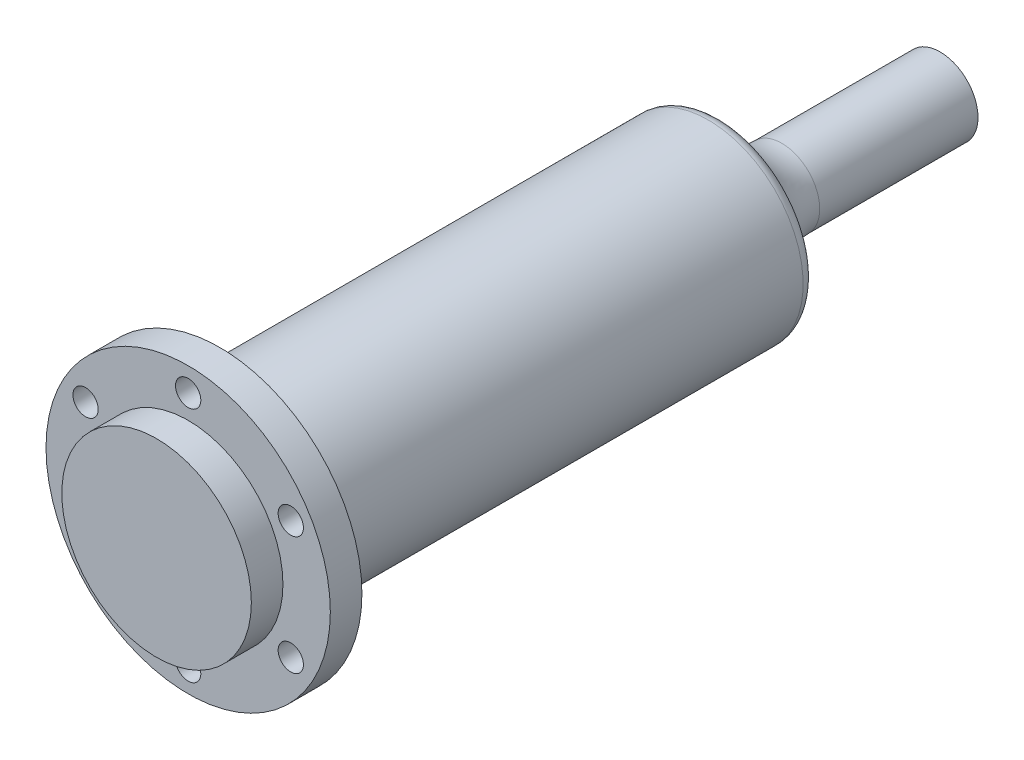
from build123d import *

# Parameters (mm, degrees)
SKETCH1_R           = 15
BOSS_EXTRUDE1_DEPTH = 72
SKETCH3_R           = 15
SKETCH3_R_2         = 7.5
BOSS_EXTRUDE2_DEPTH = 17
BOSS_EXTRUDE3_START = -5
SKETCH4_R           = 22.5
SKETCH4_R_2         = 12.5
SKETCH4_R_3         = 2
BOSS_EXTRUDE3_DEPTH = 5
SKETCH6_R           = 6
SKETCH6_R_2         = 3
BOSS_EXTRUDE4_DEPTH = 35
CUT_EXTRUDE2_START  = -67
SKETCH9_R           = 7.5
CUT_EXTRUDE2_DEPTH  = 67
CUT_EXTRUDE3_START  = -5
SKETCH10_R          = 3
CUT_EXTRUDE3_DEPTH  = 5
FILLET1_R           = 10
FILLET2_R           = 2
BOSS_EXTRUDE5_START = -84
SKETCH12_R          = 7.5
BOSS_EXTRUDE5_DEPTH = 84


with BuildPart() as part:
    # Sketch1 → Boss-Extrude1 (new body)
    with BuildSketch(Plane.XY):
        Circle(SKETCH1_R)
    extrude(amount=BOSS_EXTRUDE1_DEPTH)

    # Sketch3 → Boss-Extrude2 (add)
    with BuildSketch(Plane.XY.offset(72)):
        Circle(SKETCH3_R)
        Circle(SKETCH3_R_2, mode=Mode.SUBTRACT)
    extrude(amount=BOSS_EXTRUDE2_DEPTH)

    # Sketch4 → Boss-Extrude3 (add)
    with BuildSketch(Plane.XY.offset(89).offset(BOSS_EXTRUDE3_START)):
        Circle(SKETCH4_R)
        Circle(SKETCH4_R_2, mode=Mode.SUBTRACT)
        with Locations((0, 18.75)):
            Circle(SKETCH4_R_3, mode=Mode.SUBTRACT)
        with Locations((16.237976321, 9.375)):
            Circle(SKETCH4_R_3, mode=Mode.SUBTRACT)
        with Locations((16.237976321, -9.375)):
            Circle(SKETCH4_R_3, mode=Mode.SUBTRACT)
        with Locations((0, -18.75)):
            Circle(SKETCH4_R_3, mode=Mode.SUBTRACT)
        with Locations((-16.237976321, -9.375)):
            Circle(SKETCH4_R_3, mode=Mode.SUBTRACT)
        with Locations((-16.237976321, 9.375)):
            Circle(SKETCH4_R_3, mode=Mode.SUBTRACT)
    extrude(amount=-BOSS_EXTRUDE3_DEPTH)

    # Sketch6 → Boss-Extrude4 (add)
    with BuildSketch(Plane(origin=(0, 0, 0), x_dir=(-1, 0, 0), z_dir=(0, 0, -1))):
        with Locations(Location((0, 0, 0), (0, 0, 180))):
            Circle(SKETCH6_R)
        Circle(SKETCH6_R_2, mode=Mode.SUBTRACT)
    extrude(amount=BOSS_EXTRUDE4_DEPTH)

    # Sketch9 → Cut-Extrude2 (cut)
    with BuildSketch(Plane.XY.offset(72).offset(CUT_EXTRUDE2_START)):
        Circle(SKETCH9_R)
    extrude(amount=CUT_EXTRUDE2_DEPTH, mode=Mode.SUBTRACT)

    # Sketch10 → Cut-Extrude3 (cut)
    with BuildSketch(Plane(origin=(0, 0, 0), x_dir=(-1, 0, 0), z_dir=(0, 0, -1)).offset(CUT_EXTRUDE3_START)):
        with Locations(Location((0, 0, 0), (0, 0, 180))):
            Circle(SKETCH10_R)
    extrude(amount=CUT_EXTRUDE3_DEPTH, mode=Mode.SUBTRACT)

    # Fillet1
    # the kernel refuses this fillet: 10 mm, written as the material it adds along each edge
    with BuildSketch(Plane(origin=(0, 0, 0), x_dir=(1, 0, 0), z_dir=(0, 1, 0))) as fillet1_piece_1:
        with BuildLine():
            CenterArc((16, 9.949874371), FILLET1_R, 180, 84.260829523)
            Line((6, 9.949874371), (5.8, 9.949874371))
            Line((5.8, 9.949874371), (5.8, 0))
            Line((5.8, 0), (6, -0.2))
            ThreePointArc((6, -0.2), (10.5, -0.2), (14.98, -0.198997487))
            Line((14.98, -0.198997487), (15, 0))
        make_face()
    revolve(axis=Axis((0, 0, 0), (0, 0, -1)))

    # Fillet2
    fillet2_edges = [part.edges().sort_by_distance(p)[0] for p in [
        (-15, 0, 0),
    ]]
    fillet(fillet2_edges, radius=FILLET2_R)

    # Sketch12 → Boss-Extrude5 (add)
    with BuildSketch(Plane.XY.offset(89).offset(BOSS_EXTRUDE5_START)):
        Circle(SKETCH12_R)
    extrude(amount=BOSS_EXTRUDE5_DEPTH)


solid = part.part
